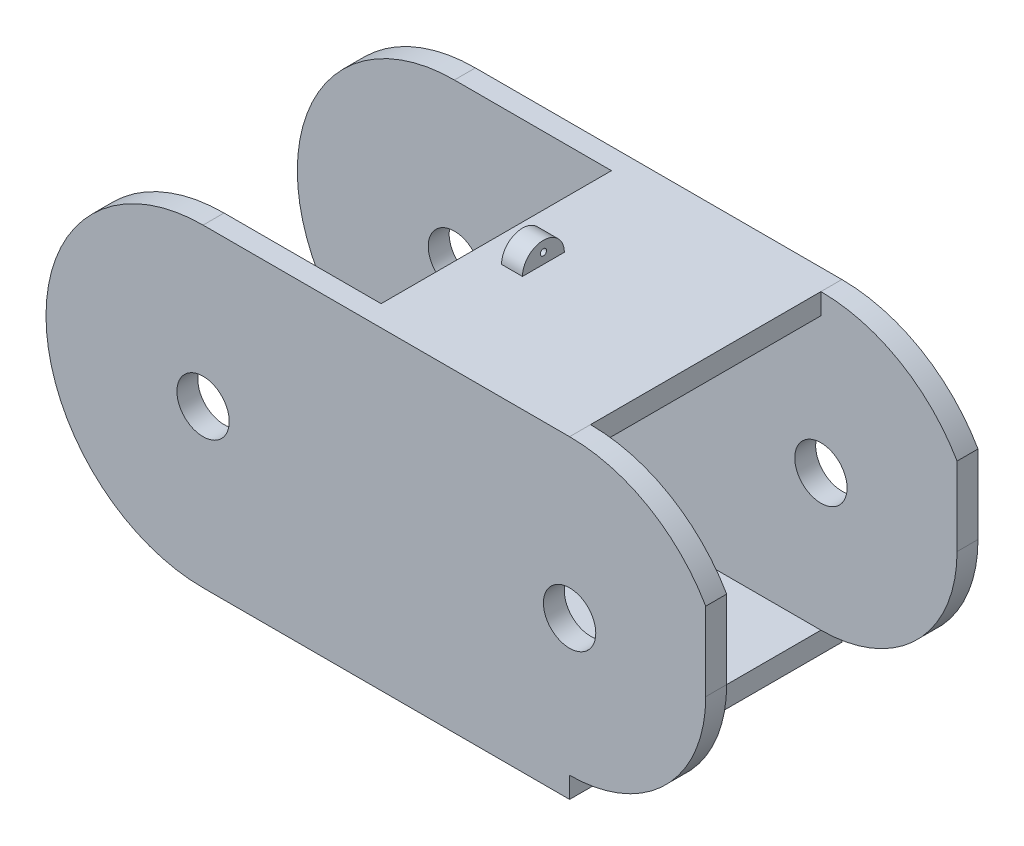
from build123d import *

# Parameters (mm, degrees)
SKETCH1_W           = 41.275
SKETCH1_H           = 19.05
BOSS_EXTRUDE1_DEPTH = 19.05
SKETCH2_R           = 1.5875
CUT_EXTRUDE1_DEPTH  = 19.05
SKETCH9_W           = 1.27
SKETCH9_H           = 2.54
BOSS_EXTRUDE2_DEPTH = 1.27
SKETCH3_R           = 0.1905
SKETCH3_W           = 13.97
SKETCH3_H           = 16.51
CUT_EXTRUDE2_DEPTH  = 21.59
SKETCH4_W           = 9.525
SKETCH4_H           = 13.97
CUT_EXTRUDE3_DEPTH  = 43.18
CUT_EXTRUDE4_DEPTH  = 19.05
SKETCH7_W           = 14.276904881
SKETCH7_H           = 13.97
CUT_EXTRUDE5_DEPTH  = 2.54
SKETCH8_W           = 4.7625
SKETCH8_H           = 13.97
CUT_EXTRUDE6_DEPTH  = 2.54


with BuildPart() as part:
    # Sketch1 → Boss-Extrude1 (new body)
    with BuildSketch(Plane(origin=(0, 0, 0), x_dir=(1, 0, 0), z_dir=(0, 1, 0))):
        Rectangle(SKETCH1_W, SKETCH1_H)
    extrude(amount=BOSS_EXTRUDE1_DEPTH)

    # Sketch2 → Cut-Extrude1 (cut)
    with BuildSketch(Plane.XY.offset(9.525)):
        with Locations((-11.1125, 9.525)):
            Circle(SKETCH2_R)
        with Locations((11.1125, 9.525)):
            Circle(SKETCH2_R)
        with BuildLine():
            ThreePointArc((-11.1125, 19.05), (-20.6375, 9.525), (-11.1125, 0))
            ThreePointArc((-11.1125, 0), (-31.327265451, 9.525), (-11.1125, 19.05))
        make_face()
        with BuildLine():
            ThreePointArc((11.1125, 19.05), (31.327265451, 9.525), (11.1125, 0))
            ThreePointArc((11.1125, 0), (20.6375, 9.525), (11.1125, 19.05))
        make_face()
    extrude(amount=-CUT_EXTRUDE1_DEPTH, mode=Mode.SUBTRACT)

    # Sketch9 → Boss-Extrude2 (add)
    with BuildSketch(Plane(origin=(0, 19.05, 0), x_dir=(1, 0, 0), z_dir=(0, 1, 0))):
        with Locations((0.635, 0)):
            Rectangle(SKETCH9_W, SKETCH9_H)
    extrude(amount=BOSS_EXTRUDE2_DEPTH)

    # Sketch3 → Cut-Extrude2 (cut, symmetric)
    with BuildSketch(Plane(origin=(0, 0, 0), x_dir=(0, 0, -1), z_dir=(1, 0, 0))):
        with Locations((0, 19.685)):
            Circle(SKETCH3_R)
        with Locations((0, 9.525)):
            Rectangle(SKETCH3_W, SKETCH3_H)
        with BuildLine():
            ThreePointArc((-1.27, 19.05), (0, 20.32), (1.27, 19.05))
            ThreePointArc((1.27, 19.05), (0, 21.164712987), (-1.27, 19.05))
        make_face()
    extrude(amount=CUT_EXTRUDE2_DEPTH, both=True, mode=Mode.SUBTRACT)

    # Sketch4 → Cut-Extrude3 (cut)
    with BuildSketch(Plane(origin=(0, 19.05, 0), x_dir=(1, 0, 0), z_dir=(0, 1, 0))):
        Polygon((-20.6375, -9.525), (11.1125, -9.525), (20.6375, -9.525), (20.6375, -8.255), (-11.1125, -8.255), (-20.6375, -8.255), align=None)
        Polygon((-11.1125, 8.255), (-20.6375, 8.255), (-20.6375, 9.525), (-11.1125, 9.525), (20.6375, 9.525), (20.6375, 8.255), align=None)
        with Locations((15.875, 0)):
            Rectangle(SKETCH4_W, SKETCH4_H)
    extrude(amount=-CUT_EXTRUDE3_DEPTH, mode=Mode.SUBTRACT)

    # Sketch6 → Cut-Extrude4 (cut)
    with BuildSketch(Plane.XY.offset(9.525)):
        with BuildLine():
            Line((11.1125, 0), (22.212486219, 0))
            Line((22.212486219, 0), (22.212486219, 1.27))
            Line((22.212486219, 1.27), (23.634495001, 11.494205363))
            Line((23.634495001, 11.494205363), (19.3675, 17.932275686))
            Line((19.3675, 17.932275686), (19.3675, 9.525))
            ThreePointArc((19.3675, 9.525), (16.949666479, 3.687833521), (11.1125, 1.27))
            Line((11.1125, 1.27), (11.1125, 0))
        make_face()
    extrude(amount=-CUT_EXTRUDE4_DEPTH, mode=Mode.SUBTRACT)

    # Sketch7 → Cut-Extrude5 (cut)
    with BuildSketch(Plane(origin=(0, 19.05, 0), x_dir=(1, 0, 0), z_dir=(0, 1, 0))):
        with Locations((-8.725952441, 0)):
            Rectangle(SKETCH7_W, SKETCH7_H)
    extrude(amount=-CUT_EXTRUDE5_DEPTH, mode=Mode.SUBTRACT)

    # Sketch8 → Cut-Extrude6 (cut)
    with BuildSketch(Plane(origin=(0, 0, 0), x_dir=(1, 0, 0), z_dir=(0, 1, 0))):
        with Locations((-13.49375, 0)):
            Rectangle(SKETCH8_W, SKETCH8_H)
    extrude(amount=CUT_EXTRUDE6_DEPTH, mode=Mode.SUBTRACT)


solid = part.part
